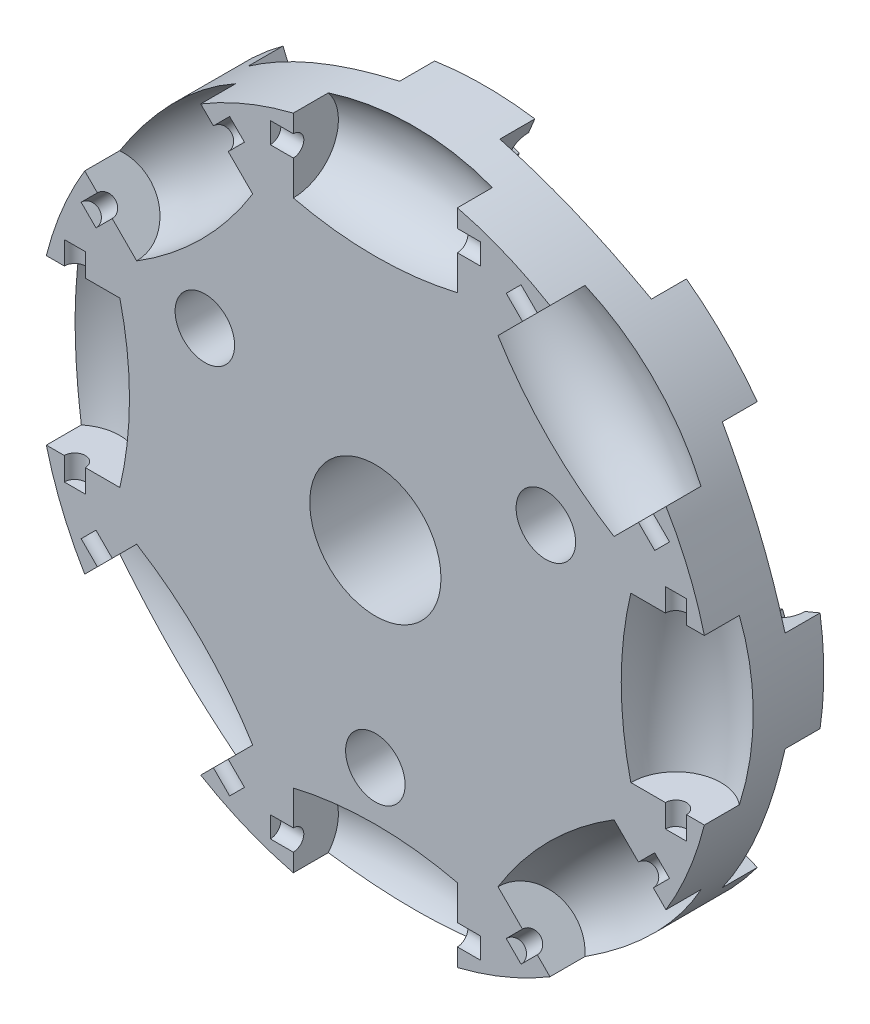
from build123d import *

# Parameters (mm, degrees)
SKETCH1_R           = 24.60625
BOSS_EXTRUDE1_DEPTH = 3.96875
SKETCH6_R           = 0.762
CUT_EXTRUDE2_DEPTH  = 7.62
SKETCH10_R          = 0.889
CUT_EXTRUDE3_DEPTH  = 7.9375
CIRPATTERN1_COUNT   = 8
SKETCH16_R          = 2.159
CUT_EXTRUDE7_DEPTH  = 36.69228202
SKETCH17_R          = 4.7625
CUT_EXTRUDE8_DEPTH  = 36.69228202


with BuildPart() as part:
    # Sketch1 → Boss-Extrude1 (new, symmetric)
    with BuildSketch(Plane.XY):
        Circle(SKETCH1_R)
    extrude(amount=BOSS_EXTRUDE1_DEPTH, both=True)

    # Sketch5 → Cut-Revolve5 (revolve, cut)
    with BuildSketch(Plane.XY.offset(3.96875)):
        with BuildLine():
            Line((-5.953125, 25.084263269), (-5.953125, 21.81225))
            Line((-5.953125, 21.81225), (5.953125, 21.81225))
            Line((5.953125, 21.81225), (5.953125, 25.084263269))
            ThreePointArc((5.953125, 25.084263269), (0, 25.781), (-5.953125, 25.084263269))
        make_face()
    cut_revolve5 = revolve(axis=Axis((-5.953125, 21.81225, 3.96875), (1, 0, 0)), mode=Mode.SUBTRACT)

    # Sketch8 → Cut-Revolve6 (revolve, cut)
    with BuildSketch(Plane.XY.offset(-3.96875)):
        with BuildLine():
            Line((4.099361624, 25.45299973), (2.847216356, 22.430053641))
            Line((2.847216356, 22.430053641), (13.84715704, 17.873729025))
            Line((13.84715704, 17.873729025), (15.099302308, 20.896675114))
            ThreePointArc((15.099302308, 20.896675114), (9.86596157, 23.818538228), (4.099361624, 25.45299973))
        make_face()
    cut_revolve6 = revolve(axis=Axis((2.847216356, 22.430053641, -3.96875), (-0.9238795325112865, 0.3826834323650905, 0)), mode=Mode.SUBTRACT)

    # Sketch6 → Cut-Extrude2 (cut, symmetric)
    with BuildSketch(Plane(origin=(0, 0, 0), x_dir=(0, 0, -1), z_dir=(1, 0, 0))):
        with Locations((-3.96875, 21.81225)):
            Circle(SKETCH6_R)
    cut_extrude2 = extrude(amount=CUT_EXTRUDE2_DEPTH, both=True, mode=Mode.SUBTRACT)

    # Sketch10 → Cut-Extrude3 (cut, symmetric)
    with BuildSketch(Plane(origin=(0, 0, 0), x_dir=(0, 0, -1), z_dir=(0.9238795325112866, -0.38268343236509017, 0))):
        with Locations((3.96875, 21.81225)):
            Circle(SKETCH10_R)
    cut_extrude3 = extrude(amount=CUT_EXTRUDE3_DEPTH, both=True, mode=Mode.SUBTRACT)

    # CirPattern1: Cut-Revolve5, Cut-Revolve6, Cut-Extrude2, Cut-Extrude3 ×8 about axis
    cirpattern1_axis = Axis((0, 0, 3.96875), (0, 0, -1))
    add([cut_revolve5.rotate(cirpattern1_axis, i * 360 / CIRPATTERN1_COUNT) for i in range(1, CIRPATTERN1_COUNT)], mode=Mode.SUBTRACT)
    add([cut_revolve6.rotate(cirpattern1_axis, i * 360 / CIRPATTERN1_COUNT) for i in range(1, CIRPATTERN1_COUNT)], mode=Mode.SUBTRACT)
    add([cut_extrude2.rotate(cirpattern1_axis, i * 360 / CIRPATTERN1_COUNT) for i in range(1, CIRPATTERN1_COUNT)], mode=Mode.SUBTRACT)
    add([cut_extrude3.rotate(cirpattern1_axis, i * 360 / CIRPATTERN1_COUNT) for i in range(1, CIRPATTERN1_COUNT)], mode=Mode.SUBTRACT)

    # Sketch16 → Cut-Extrude7 (cut, through all)
    with BuildSketch(Plane.XY.offset(3.96875)):
        with Locations((0, -14.2875)):
            Circle(SKETCH16_R)
        with Locations((-12.373337957, 7.14375)):
            Circle(SKETCH16_R)
        with Locations((12.373337957, 7.14375)):
            Circle(SKETCH16_R)
    extrude(amount=-CUT_EXTRUDE7_DEPTH, mode=Mode.SUBTRACT)

    # Sketch17 → Cut-Extrude8 (cut, through all)
    with BuildSketch(Plane.XY.offset(3.96875)):
        Circle(SKETCH17_R)
    extrude(amount=-CUT_EXTRUDE8_DEPTH, mode=Mode.SUBTRACT)


solid = part.part
